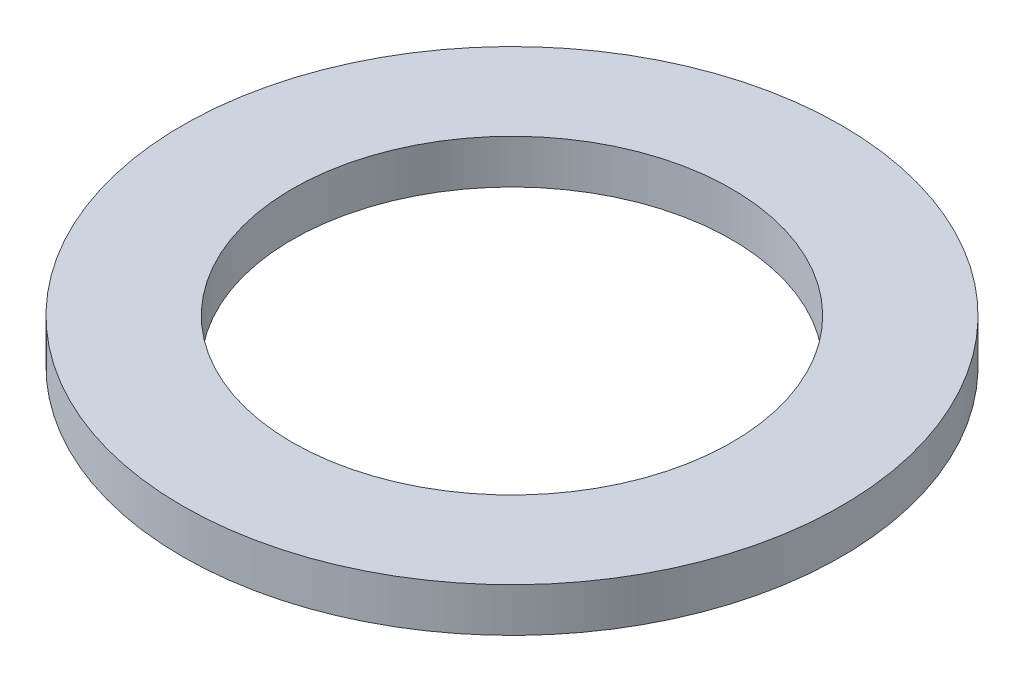
from build123d import *

# Parameters (mm, degrees)
SKETCH1_R           = 52.5
BOSS_EXTRUDE1_DEPTH = 7
SKETCH2_R           = 35
CUT_EXTRUDE1_DEPTH  = 75.575465134


with BuildPart() as part:
    # Sketch1 → Boss-Extrude1 (new body)
    with BuildSketch(Plane(origin=(0, 0, 0), x_dir=(1, 0, 0), z_dir=(0, 1, 0))):
        Circle(SKETCH1_R)
    extrude(amount=BOSS_EXTRUDE1_DEPTH)

    # Sketch2 → Cut-Extrude1 (cut, through all)
    with BuildSketch(Plane(origin=(0, 0, 0), x_dir=(1, 0, 0), z_dir=(0, 1, 0))):
        Circle(SKETCH2_R)
    extrude(amount=CUT_EXTRUDE1_DEPTH, mode=Mode.SUBTRACT)


solid = part.part
